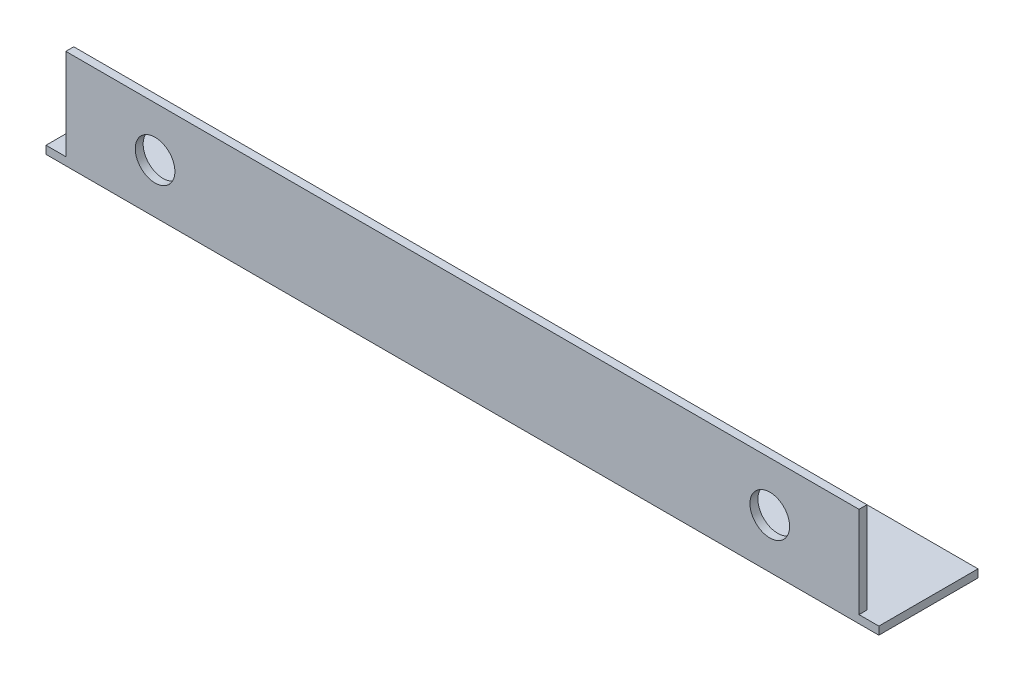
from build123d import *

# Parameters (mm, degrees)
EXTRUDE_1_DEPTH     = 210
SKETCH_2_R          = 5
SKETCH_2_W          = 5
SKETCH_2_H          = 23
CUT_EXTRUDE_1_DEPTH = 213.95539439


with BuildPart() as part:
    # Эскиз1 → Вытянуть-Тонкостенный1 (new body)
    with BuildSketch(Plane(origin=(0, 0, 0), x_dir=(0, 0, -1), z_dir=(1, 0, 0))):
        Polygon((0, 25), (0, 0), (25, 0), (25, 2), (2, 2), (2, 25), align=None)
    extrude(amount=EXTRUDE_1_DEPTH)

    # Эскиз2 → Вырез-Вытянуть1 (cut, through all)
    with BuildSketch(Plane.XY):
        with Locations((27.5, 12.5)):
            Circle(SKETCH_2_R)
        with Locations((182.5, 12.5)):
            Circle(SKETCH_2_R)
        with Locations((207.5, 13.5)):
            Rectangle(SKETCH_2_W, SKETCH_2_H)
        with Locations((2.5, 13.5)):
            Rectangle(SKETCH_2_W, SKETCH_2_H)
    extrude(amount=-CUT_EXTRUDE_1_DEPTH, mode=Mode.SUBTRACT)


solid = part.part
